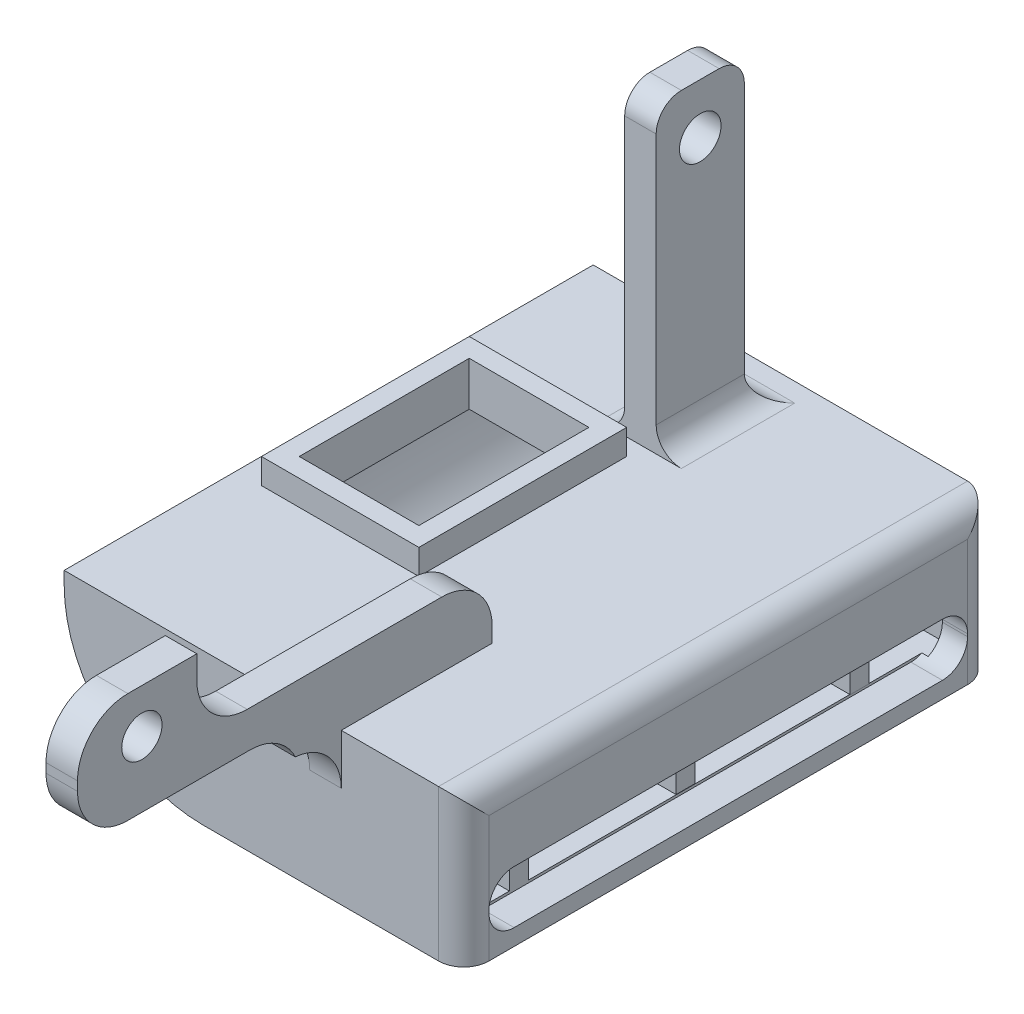
from build123d import *

# Parameters (mm, degrees)
SALIENTE_EXTRUIR1_DEPTH  = 12
CROQUIS2_W               = 12.5
CROQUIS2_H               = 16.5
CROQUIS2_W_2             = 9.5
CROQUIS2_H_2             = 13.5
SALIENTE_EXTRUIR2_DEPTH  = 2
SALIENTE_EXTRUIR4_DEPTH  = 11
CROQUIS4_R               = 1.6
CORTAR_EXTRUIR1_DEPTH    = 2.5
CROQUIS5_W               = 17.29289048
CROQUIS5_H               = 2.276098228
CROQUIS5_W_2             = 23.449996424
CROQUIS5_H_2             = 5.821617307
CORTAR_EXTRUIR2_DEPTH    = 2
SALIENTE_EXTRUIR5_DEPTH  = 3
CROQUIS7_W               = 60
CROQUIS7_H               = 12
SALIENTE_EXTRUIR6_DEPTH  = 3
CORTAR_EXTRUIR3_DEPTH    = 42
VACIADO4_START           = -15.778481013
VACIADO4_DEPTH           = 39
VACIADO4_2_OUTLINE_W     = 28
VACIADO4_2_OUTLINE_H     = 9
VACIADO4_2_DEPTH         = 4
VACIADO4_START_2         = 19.221518987
VACIADO4_3_OUTLINE_W     = 28
VACIADO4_3_OUTLINE_H     = 9
VACIADO4_3_DEPTH         = 4
VACIADO4_START_3         = -3.938481013
VACIADO4_4_OUTLINE_W     = 9.5
VACIADO4_4_OUTLINE_H     = 1.5
VACIADO4_4_DEPTH         = 13.5
REDONDEO2_R              = 4
REDONDEO3_R              = 4
CROQUIS10_W              = 2.5
CROQUIS10_H              = 7
SALIENTE_EXTRUIR8_DEPTH  = 24
CROQUIS11_R              = 1.65
CORTAR_EXTRUIR4_DEPTH    = 2.5
CROQUIS14_R              = 1.6
SALIENTE_EXTRUIR10_DEPTH = 0.5
CROQUIS15_W              = 28.276285021
CROQUIS15_H              = 42
CORTAR_EXTRUIR5_DEPTH    = 12
CROQUIS16_W              = 42
CROQUIS16_H              = 12
SALIENTE_EXTRUIR11_DEPTH = 2
CORTAR_EXTRUIR6_DEPTH    = 2.5
CROQUIS19_W              = 18.223714979
CROQUIS19_H              = 1.5
SALIENTE_EXTRUIR16_DEPTH = 9
REDONDEO4_R              = 2
REDONDEO5_R              = 2
REDONDEO6_R              = 2


with BuildPart() as part:
    # Croquis1 → Saliente-Extruir1 (new body)
    with BuildSketch(Plane(origin=(0, 0, 0), x_dir=(1, 0, 0), z_dir=(0, 1, 0))):
        Polygon((30.683544304, -17.721518987), (30.683544304, -21.721518987), (-29.316455696, -21.721518987), (-29.316455696, 14.278481013), (30.683544304, 14.278481013), (30.683544304, 10.278481013), (2.683544304, 10.278481013), (2.683544304, -17.721518987), align=None)
    extrude(amount=SALIENTE_EXTRUIR1_DEPTH)

    # Croquis2 → Saliente-Extruir2 (add)
    with BuildSketch(Plane(origin=(0, 12, 0), x_dir=(1, 0, 0), z_dir=(0, 1, 0))):
        with Locations((-21.066455696, -2.811518987)):
            Rectangle(CROQUIS2_W, CROQUIS2_H)
        with Locations((-21.066455696, -2.811518987)):
            Rectangle(CROQUIS2_W_2, CROQUIS2_H_2, mode=Mode.SUBTRACT)
    extrude(amount=SALIENTE_EXTRUIR2_DEPTH)

    # Croquis3 → Saliente-Extruir4 (add)
    with BuildSketch(Plane(origin=(0, 12, 0), x_dir=(1, 0, 0), z_dir=(0, 1, 0))):
        Polygon((-7.816455696, -12.741518987), (-7.816455696, -41.560532566), (-7.816455696, -45.664219129), (-9.816455696, -45.664219129), (-9.816455696, -41.560532566), (-9.816455696, -12.741518987), align=None)
    extrude(amount=SALIENTE_EXTRUIR4_DEPTH)

    # Croquis4 → Cortar-Extruir1 (cut)
    with BuildSketch(Plane.ZY.offset(9.816455696)):
        with Locations((40.551518987, 19.507537468)):
            Circle(CROQUIS4_R)
    extrude(amount=-CORTAR_EXTRUIR1_DEPTH, mode=Mode.SUBTRACT)

    # Croquis5 → Cortar-Extruir2 (cut)
    with BuildSketch(Plane.ZY.offset(9.816455696)):
        with Locations((37.017773889, 13.138049114)):
            Rectangle(CROQUIS5_W, CROQUIS5_H)
        with Locations((24.466517199, 20.089191347)):
            Rectangle(CROQUIS5_W_2, CROQUIS5_H_2)
    extrude(amount=-CORTAR_EXTRUIR2_DEPTH, mode=Mode.SUBTRACT)

    # Croquis6 → Saliente-Extruir5 (add)
    with BuildSketch(Plane.XY.offset(21.721518987)):
        Polygon((-29.316455696, 0), (30.683544304, 0), (30.683544304, 12), (-7.816455696, 12), (-9.816455696, 12), (-29.316455696, 12), align=None)
    extrude(amount=SALIENTE_EXTRUIR5_DEPTH)

    # Croquis7 → Saliente-Extruir6 (add)
    with BuildSketch(Plane(origin=(0, 0, -14.278481013), x_dir=(-1, 0, 0), z_dir=(0, 0, -1))):
        with Locations((-0.683544304, 6)):
            Rectangle(CROQUIS7_W, CROQUIS7_H)
    extrude(amount=SALIENTE_EXTRUIR6_DEPTH)

    # Croquis8 → Cortar-Extruir3 (cut)
    with BuildSketch(Plane.XY.offset(24.721518987)):
        with BuildLine():
            Line((-29.316455696, 0), (-18.316455696, 0))
            ThreePointArc((-18.316455696, 0), (-26.094630289, 3.221825407), (-29.316455696, 11))
            Line((-29.316455696, 11), (-29.316455696, 0))
        make_face()
    extrude(amount=-CORTAR_EXTRUIR3_DEPTH, mode=Mode.SUBTRACT)

    # Vaciado4: read off the stored shape, not the designer's step
    # Vaciado4 outline → Vaciado4 (cut)
    with BuildSketch(Plane.XY.offset(VACIADO4_START)):
        with BuildLine():
            Line((1.183544304, 10.5), (-27.803288677, 10.5))
            ThreePointArc((-27.803288677, 10.5), (-24.854804112, 4.107975624), (-18.316455696, 1.5))
            Line((-18.316455696, 1.5), (1.183544304, 1.5))
            Line((1.183544304, 1.5), (1.183544304, 10.5))
        make_face()
    extrude(amount=VACIADO4_DEPTH, mode=Mode.SUBTRACT)

    # Vaciado4 2 outline → Vaciado4 2 (cut)
    with BuildSketch(Plane.XY.offset(VACIADO4_START)):
        with Locations((15.183544304, 6)):
            Rectangle(VACIADO4_2_OUTLINE_W, VACIADO4_2_OUTLINE_H)
    extrude(amount=VACIADO4_2_DEPTH, mode=Mode.SUBTRACT)

    # Vaciado4 3 outline → Vaciado4 3 (cut)
    with BuildSketch(Plane.XY.offset(VACIADO4_START_2)):
        with Locations((15.183544304, 6)):
            Rectangle(VACIADO4_3_OUTLINE_W, VACIADO4_3_OUTLINE_H)
    extrude(amount=VACIADO4_3_DEPTH, mode=Mode.SUBTRACT)

    # Vaciado4 4 outline → Vaciado4 4 (cut)
    with BuildSketch(Plane.XY.offset(VACIADO4_START_3)):
        with Locations((-21.066455696, 11.25)):
            Rectangle(VACIADO4_4_OUTLINE_W, VACIADO4_4_OUTLINE_H)
    extrude(amount=VACIADO4_4_DEPTH, mode=Mode.SUBTRACT)

    # Redondeo2
    # the kernel refuses this fillet: 4 mm, written as the material it adds along each edge
    with BuildSketch(Plane(origin=(-9.816455696, 12, 24.721518987), x_dir=(0, -1, 0), z_dir=(1, 0, 0))) as redondeo2_piece_1:
        with BuildLine():
            CenterArc((3.984641355, -4), REDONDEO2_R, 90, 84.977462971)
            Line((0, -3.649809662), (0, 0))
            Line((0, 0), (3.984641355, 0))
        make_face()
    extrude(amount=2)
    with BuildSketch(Plane(origin=(-9.816455696, 14.276098228, 28.371328649), x_dir=(0, 0, 1), z_dir=(1, 0, 0))) as redondeo2_piece_2:
        with BuildLine():
            CenterArc((3.609454623, 4), REDONDEO2_R, 205.52948015, 64.47051985)
            Line((0, 2.276098228), (0, 0))
            Line((0, 0), (3.609454623, 0))
        make_face()
    extrude(amount=2)
    with BuildSketch(Plane(origin=(-9.816455696, 17.178382693, 36.191515411), x_dir=(0, 0, -1), z_dir=(1, 0, 0))) as redondeo2_piece_3:
        with BuildLine():
            CenterArc((REDONDEO2_R, REDONDEO2_R), REDONDEO2_R, 180, 90)
            Line((0, REDONDEO2_R), (0, 0))
            Line((0, 0), (REDONDEO2_R, 0))
        make_face()
    extrude(amount=2)
    # the kernel refuses this fillet: 4 mm, written as the material it takes off along each edge
    with BuildSketch(Plane(origin=(-19.816455696, 17.178382693, 12.741518987), x_dir=(0, 0, 1), z_dir=(1, 0, 0))) as redondeo2_2_piece_1:
        with BuildLine():
            CenterArc((REDONDEO2_R, REDONDEO2_R), REDONDEO2_R, 180, 90)
            Line((0, REDONDEO2_R), (0, 0))
            Line((0, 0), (REDONDEO2_R, 0))
        make_face()
    extrude(amount=22, mode=Mode.SUBTRACT)

    # Redondeo3
    redondeo3_edges = [part.edges().sort_by_distance(p)[0] for p in [
        (-8.816455696, 23, 45.664219129),
        (-8.816455696, 14.276098228, 45.664219129),
    ]]
    fillet(redondeo3_edges, radius=REDONDEO3_R)

    # Croquis10 → Saliente-Extruir8 (add)
    with BuildSketch(Plane(origin=(0, 12, 0), x_dir=(1, 0, 0), z_dir=(0, 1, 0))):
        with Locations((-15.066455696, 10.278481013)):
            Rectangle(CROQUIS10_W, CROQUIS10_H)
    extrude(amount=SALIENTE_EXTRUIR8_DEPTH)

    # Croquis11 → Cortar-Extruir4 (cut)
    with BuildSketch(Plane.ZY.offset(16.316455696)):
        with Locations((-10.278481013, 32.003262859)):
            Circle(CROQUIS11_R)
    extrude(amount=-CORTAR_EXTRUIR4_DEPTH, mode=Mode.SUBTRACT)

    # Croquis14 → Saliente-Extruir10 (add)
    with BuildSketch(Plane(origin=(-7.816455696, 0, 0), x_dir=(0, 0, -1), z_dir=(1, 0, 0))):
        with BuildLine():
            Line((-36.191515411, 23), (-41.664219129, 23))
            ThreePointArc((-41.664219129, 23), (-44.492646254, 21.828427125), (-45.664219129, 19))
            Line((-45.664219129, 19), (-45.664219129, 18.276098228))
            ThreePointArc((-45.664219129, 18.276098228), (-44.492646254, 15.447671103), (-41.664219129, 14.276098228))
            Line((-41.664219129, 14.276098228), (-31.980783273, 14.276098228))
            ThreePointArc((-31.980783273, 14.276098228), (-29.847195577, 13.659558519), (-28.371328649, 12))
            ThreePointArc((-28.371328649, 12), (-25.771878217, 10.717139414), (-24.721518987, 8.015358645))
            Line((-24.721518987, 8.015358645), (-24.721518987, 12))
            Line((-24.721518987, 12), (-12.741518987, 12))
            Line((-12.741518987, 12), (-12.741518987, 13.178382693))
            ThreePointArc((-12.741518987, 13.178382693), (-13.913091863, 16.006809817), (-16.741518987, 17.178382693))
            Line((-16.741518987, 17.178382693), (-32.191515411, 17.178382693))
            ThreePointArc((-32.191515411, 17.178382693), (-35.019942535, 18.349955568), (-36.191515411, 21.178382693))
            Line((-36.191515411, 21.178382693), (-36.191515411, 23))
        make_face()
        with Locations(Location((-40.551518987, 19.507537468, 0), (0, 0, 180))):
            Circle(CROQUIS14_R, mode=Mode.SUBTRACT)
    extrude(amount=SALIENTE_EXTRUIR10_DEPTH)

    # Croquis15 → Cortar-Extruir5 (cut)
    with BuildSketch(Plane(origin=(0, 12, 0), x_dir=(1, 0, 0), z_dir=(0, 1, 0))):
        with Locations((16.545401794, -3.721518987)):
            Rectangle(CROQUIS15_W, CROQUIS15_H)
    extrude(amount=-CORTAR_EXTRUIR5_DEPTH, mode=Mode.SUBTRACT)

    # Croquis16 → Saliente-Extruir11 (add)
    with BuildSketch(Plane(origin=(2.407259283, 0, 0), x_dir=(0, 0, -1), z_dir=(1, 0, 0))):
        with Locations((-3.721518987, 6)):
            Rectangle(CROQUIS16_W, CROQUIS16_H)
    extrude(amount=-SALIENTE_EXTRUIR11_DEPTH)

    # Croquis18 → Cortar-Extruir6 (cut)
    with BuildSketch(Plane(origin=(2.407259283, 0, 0), x_dir=(0, 0, -1), z_dir=(1, 0, 0))):
        with BuildLine():
            Line((-20.721518987, 5.5), (13.278481013, 5.5))
            ThreePointArc((13.278481013, 5.5), (14.692694575, 4.914213562), (15.278481013, 3.5))
            Line((15.278481013, 3.5), (15.278481013, 3.3))
            ThreePointArc((15.278481013, 3.3), (14.692694575, 1.885786438), (13.278481013, 1.3))
            Line((13.278481013, 1.3), (-20.721518987, 1.3))
            ThreePointArc((-20.721518987, 1.3), (-22.13573255, 1.885786438), (-22.721518987, 3.3))
            Line((-22.721518987, 3.3), (-22.721518987, 3.5))
            ThreePointArc((-22.721518987, 3.5), (-22.13573255, 4.914213562), (-20.721518987, 5.5))
        make_face()
    extrude(amount=-CORTAR_EXTRUIR6_DEPTH, mode=Mode.SUBTRACT)

    # Croquis19 → Saliente-Extruir16 (add)
    with BuildSketch(Plane(origin=(0, 1.5, 0), x_dir=(1, 0, 0), z_dir=(0, 1, 0))):
        with Locations((-9.204598207, -17.846071371)):
            Rectangle(CROQUIS19_W, CROQUIS19_H)
        with Locations((-9.224216979, -4.59531752)):
            Rectangle(CROQUIS19_W, CROQUIS19_H)
        with Locations((-9.175696895, 9.179239743)):
            Rectangle(CROQUIS19_W, CROQUIS19_H)
    extrude(amount=SALIENTE_EXTRUIR16_DEPTH)

    # Redondeo4
    # the kernel refuses this fillet: 2 mm, written as the material it takes off along each edge
    with BuildSketch(Plane(origin=(2.407259283, 12, -22.278481013), x_dir=(-1, 0, 0), z_dir=(0, 0, 1))) as redondeo4_piece_1:
        with BuildLine():
            CenterArc((REDONDEO4_R, REDONDEO4_R), REDONDEO4_R, 180, 90)
            Line((0, REDONDEO4_R), (0, 0))
            Line((0, 0), (REDONDEO4_R, 0))
        make_face()
    extrude(amount=52, mode=Mode.SUBTRACT)
    with BuildSketch(Plane(origin=(2.407259283, 17, 24.721518987), x_dir=(-1, 0, 0), z_dir=(0, -1, 0)), Plane(origin=(2.407259283, 17, -17.278481013), x_dir=(0, 0, 1), z_dir=(0, -1, 0))) as redondeo4_piece_2:
        with BuildLine():
            CenterArc((REDONDEO4_R, REDONDEO4_R), REDONDEO4_R, 180, 90)
            Line((0, REDONDEO4_R), (0, 0))
            Line((0, 0), (REDONDEO4_R, 0))
        make_face()
    extrude(amount=22, mode=Mode.SUBTRACT)

    # Redondeo5
    redondeo5_edges = [part.edges().sort_by_distance(p)[0] for p in [
        (-15.066455696, 36, -13.778481013),
        (-15.066455696, 36, -6.778481013),
    ]]
    fillet(redondeo5_edges, radius=REDONDEO5_R)

    # Redondeo6
    redondeo6_edges = [part.edges().sort_by_distance(p)[0] for p in [
        (-13.816455696, 12, -10.278481013),
        (-15.066455696, 12, -13.778481013),
        (-16.316455696, 12, -10.278481013),
    ]]
    fillet(redondeo6_edges, radius=REDONDEO6_R)


solid = part.part
